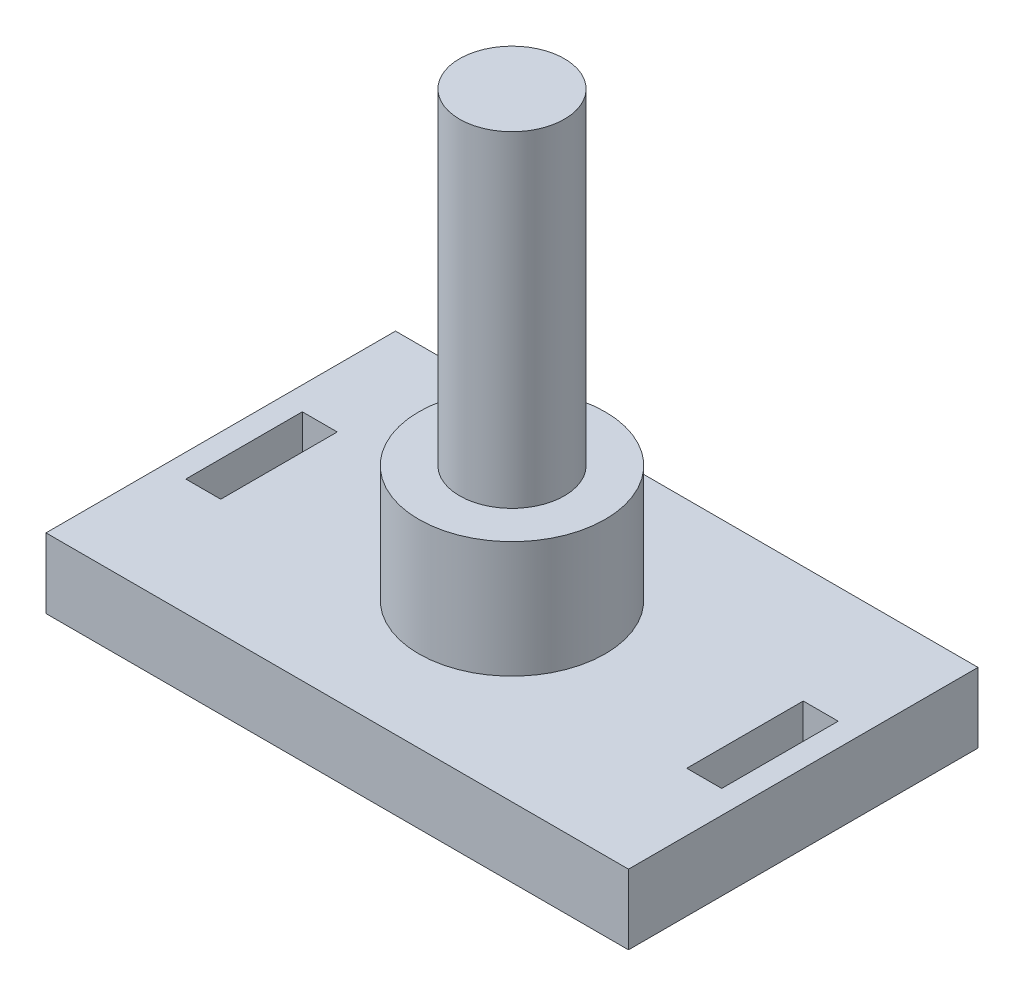
from build123d import *

# Parameters (mm, degrees)
SKETCH1_R           = 2.25
BOSS_EXTRUDE1_DEPTH = 14
SKETCH2_R           = 4
BOSS_EXTRUDE2_DEPTH = 5
SKETCH3_W           = 25
SKETCH3_H           = 15
BOSS_EXTRUDE3_DEPTH = 3
SKETCH4_W           = 1.5
SKETCH4_H           = 5
CUT_EXTRUDE1_DEPTH  = 3


with BuildPart() as part:
    # Sketch1 → Boss-Extrude1 (new body)
    with BuildSketch(Plane(origin=(0, 0, 0), x_dir=(1, 0, 0), z_dir=(0, 1, 0))):
        Circle(SKETCH1_R)
    extrude(amount=BOSS_EXTRUDE1_DEPTH)

    # Sketch2 → Boss-Extrude2 (add)
    with BuildSketch(Plane.XZ):
        Circle(SKETCH2_R)
    extrude(amount=BOSS_EXTRUDE2_DEPTH)

    # Sketch3 → Boss-Extrude3 (add)
    with BuildSketch(Plane.XZ.offset(5)):
        Rectangle(SKETCH3_W, SKETCH3_H)
    extrude(amount=BOSS_EXTRUDE3_DEPTH)

    # Sketch4 → Cut-Extrude1 (cut)
    with BuildSketch(Plane.XZ.offset(8)):
        with Locations((-10.75, 0)):
            Rectangle(SKETCH4_W, SKETCH4_H)
        with Locations((10.75, 0)):
            Rectangle(SKETCH4_W, SKETCH4_H)
    extrude(amount=-CUT_EXTRUDE1_DEPTH, mode=Mode.SUBTRACT)


solid = part.part
